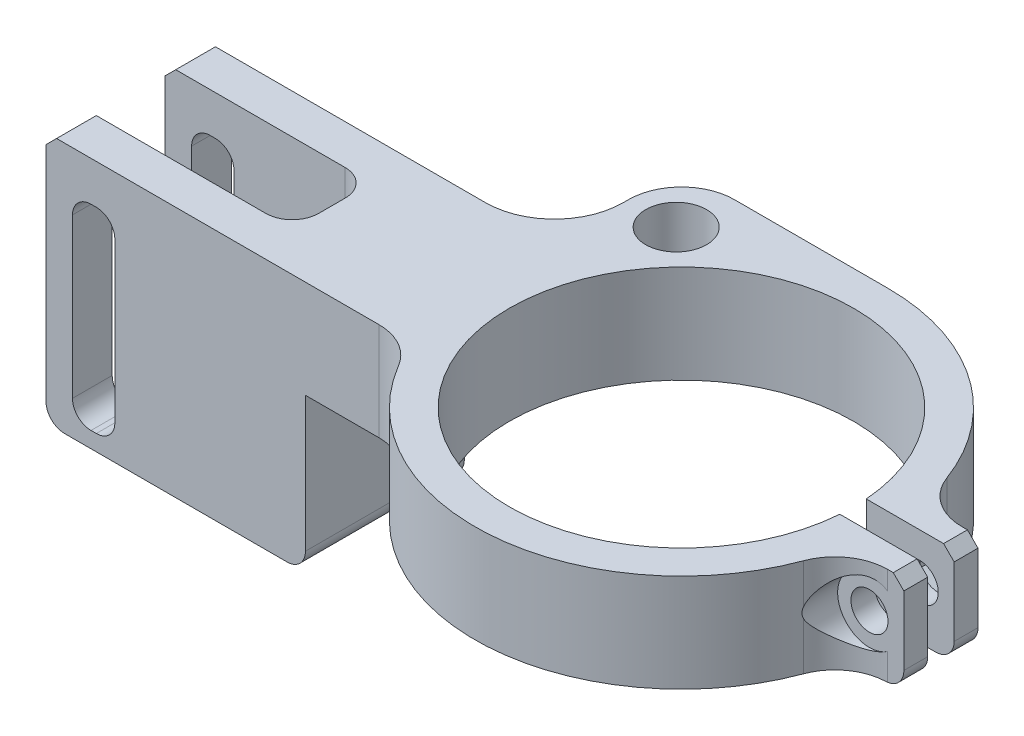
from build123d import *

# Parameters (mm, degrees)
SKETCH1_R               = 5.75
BOSS_EXTRUDE1_DEPTH     = 18.5
BOSS_EXTRUDE2_DEPTH     = 29
CUT_EXTRUDE1_DEPTH      = 126.623445264
CUT_EXTRUDE2_DEPTH      = 122.581248554
FILLET1_R               = 3.5
CHAMFER1_SIZE           = 2
CUT_EXTRUDE3_DEPTH      = 119.245507314
CUT_EXTRUDE3_DEPTH_BACK = 119.245507314
SKETCH7_R               = 3.5
CUT_EXTRUDE4_DEPTH      = 10
CUT_EXTRUDE4_DEPTH_BACK = 1
SKETCH9_R               = 6
CUT_EXTRUDE5_DEPTH      = 10
FILLET3_R               = 3.5
CHAMFER2_SIZE           = 2
FILLET4_R               = 5


with BuildPart() as part:
    # Sketch1 → Boss-Extrude1 (new body)
    with BuildSketch(Plane(origin=(0, 0, 0), x_dir=(1, 0, 0), z_dir=(0, 1, 0))):
        with BuildLine():
            Line((-29, 50), (0, 50))
            ThreePointArc((0, 50), (22.285714286, 43.005420459), (36.577623382, 24.530612245))
            ThreePointArc((36.577623382, 24.530612245), (40.242215458, 19.793481934), (45.956501172, 18))
            Line((45.956501172, 18), (49, 18))
            Line((49, 18), (49, 13.5))
            Line((49, 13.5), (32.403703492, 13.5))
            ThreePointArc((32.403703492, 13.5), (-32.5, 11), (32.403703492, 8.5))
            Line((32.403703492, 8.5), (49, 8.5))
            Line((49, 8.5), (49, 4))
            Line((49, 4), (45.956501172, 4))
            ThreePointArc((45.956501172, 4), (40.242215458, 2.206518066), (36.577623382, -2.530612245))
            ThreePointArc((36.577623382, -2.530612245), (3.715197259, -27.822639134), (-33.347589544, -9.222222222))
            Line((-33.347589544, -9.222222222), (-33.594644376, -8.814814815))
            ThreePointArc((-33.594644376, -8.814814815), (-37.238774547, -5.286451588), (-42.145308361, -4))
            Line((-42.145308361, -4), (-46.173585522, -4))
            Line((-46.173585522, -4), (-74, -4))
            Line((-74, -4), (-105, -4))
            Line((-105, -4), (-105, 26))
            Line((-105, 26), (-74, 26))
            Line((-74, 26), (-52, 26))
            ThreePointArc((-52, 26), (-42.807611845, 29.807611845), (-39, 39))
            Line((-39, 39), (-39, 40))
            ThreePointArc((-39, 40), (-36.071067812, 47.071067812), (-29, 50))
        make_face()
        with Locations(Location((-30, 40, 0), (0, 0, 90))):
            Circle(SKETCH1_R, mode=Mode.SUBTRACT)
    extrude(amount=BOSS_EXTRUDE1_DEPTH)

    # Sketch3 → Boss-Extrude2 (add)
    with BuildSketch(Plane.XZ):
        Polygon((-105, -26), (-56, -26), (-56, -2.142135624), (-56, 4), (-105, 4), align=None)
    extrude(amount=BOSS_EXTRUDE2_DEPTH)

    # Sketch5 → Cut-Extrude1 (cut, through all)
    with BuildSketch(Plane(origin=(0, -29, 0), x_dir=(-1, 0, 0), z_dir=(0, -1, 0))):
        Polygon((66, 3.5), (66, 18.5), (105, 18.5), (105, 11), (105, 3.5), align=None)
    extrude(amount=-CUT_EXTRUDE1_DEPTH, mode=Mode.SUBTRACT)

    # Sketch6 → Cut-Extrude2 (cut, through all)
    with BuildSketch(Plane.XY.offset(4)):
        Polygon((-92, 11), (-100, 11), (-100, -26), (-92, -26), (-92, -5.5), align=None)
    extrude(amount=-CUT_EXTRUDE2_DEPTH, mode=Mode.SUBTRACT)

    # Fillet1
    fillet1_edges = [part.edges().sort_by_distance(p)[0] for p in [
        (-92, 11, -22.25),
        (-92, 11, 0.25),
        (-92, -26, -22.25),
        (-92, -26, 0.25),
        (-100, -26, -22.25),
        (-100, -26, 0.25),
        (-100, 11, -22.25),
        (-100, 11, 0.25),
        (-56, -29, -11),
        (-105, -29, 0.25),
        (-105, -29, -22.25),
    ]]
    fillet(fillet1_edges, radius=FILLET1_R)

    # Chamfer1
    chamfer1_edges = [part.edges().sort_by_distance(p)[0] for p in [
        (-105, 18.5, -22.25),
        (-105, 18.5, 0.25),
    ]]
    chamfer(chamfer1_edges, length=CHAMFER1_SIZE)

    # Sketch7 → Cut-Extrude3 (cut, two sides: drawn at the far end of the back side and taken through both)
    with BuildSketch(Plane.XY.offset(-4).offset(-CUT_EXTRUDE3_DEPTH_BACK)):
        with Locations(Location((42.5, 10, 0), (0, 0, 350.957402384))):
            Circle(SKETCH7_R)
    extrude(amount=CUT_EXTRUDE3_DEPTH + CUT_EXTRUDE3_DEPTH_BACK, mode=Mode.SUBTRACT)

    # Sketch8 → Cut-Extrude4 (cut, two sides: drawn at the far end of the back side and taken through both)
    with BuildSketch(Plane(origin=(0, 0, -18), x_dir=(-1, 0, 0), z_dir=(0, 0, -1)).offset(-CUT_EXTRUDE4_DEPTH_BACK)):
        Polygon((-42.5, 16.062177826), (-47.75, 13.031088913), (-47.75, 6.968911087), (-42.5, 3.937822174), (-37.25, 6.968911087), (-37.25, 13.031088913), align=None)
    extrude(amount=CUT_EXTRUDE4_DEPTH + CUT_EXTRUDE4_DEPTH_BACK, mode=Mode.SUBTRACT)

    # Sketch9 → Cut-Extrude5 (cut)
    with BuildSketch(Plane.XY.offset(-4)):
        with Locations((42.5, 10)):
            Circle(SKETCH9_R)
    extrude(amount=CUT_EXTRUDE5_DEPTH, mode=Mode.SUBTRACT)

    # Fillet3
    # the kernel refuses this fillet: 3.5 mm, written as the material it takes off along each edge
    with BuildSketch(Plane(origin=(49, 0, -26.75), x_dir=(0, 1, 0), z_dir=(0, 0, 1)), Plane(origin=(49, 0, -17.25), x_dir=(0, 1, 0), z_dir=(0, 0, 1))) as fillet3_piece_1:
        with BuildLine():
            CenterArc((FILLET3_R, FILLET3_R), FILLET3_R, 180, 90)
            Line((0, FILLET3_R), (0, 0))
            Line((0, 0), (FILLET3_R, 0))
        make_face()
    extrude(amount=22, mode=Mode.SUBTRACT)

    # Chamfer2
    chamfer2_edges = [part.edges().sort_by_distance(p)[0] for p in [
        (49, 18.5, -6.25),
        (49, 18.5, -15.75),
    ]]
    chamfer(chamfer2_edges, length=CHAMFER2_SIZE)

    # Fillet4
    fillet4_edges = [part.edges().sort_by_distance(p)[0] for p in [
        (-66, -5.25, -18.5),
        (-66, -5.25, -3.5),
    ]]
    fillet(fillet4_edges, radius=FILLET4_R)


solid = part.part
